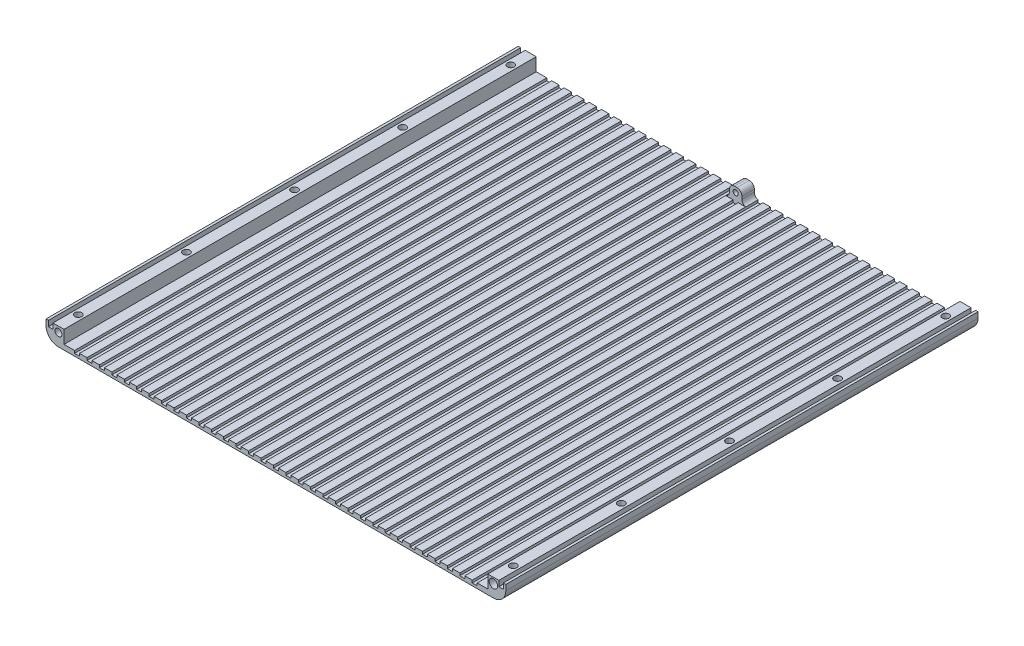
from build123d import *

# Parameters (mm, degrees)
BOSS_EXTRUDE1_DEPTH = 190
SKETCH2_R           = 1.4
CUT_EXTRUDE1_DEPTH  = 6
SKETCH3_W           = 2
SKETCH3_H           = 190
CUT_EXTRUDE2_DEPTH  = 1
LPATTERN1_COUNT     = 17
LPATTERN1_PITCH     = 5
LPATTERN1_COL_COUNT = 17
LPATTERN1_COL_PITCH = 5
SKETCH6_W           = 1.8
SKETCH6_H           = 190
CUT_EXTRUDE3_DEPTH  = 2.2
SKETCH7_R           = 1.4
SKETCH7_R_2         = 1.718448872
CUT_EXTRUDE4_DEPTH  = 4
CUT_EXTRUDE5_START  = -186
SKETCH7_2_R         = 1.4
SKETCH7_2_R_2       = 1.718448872
CUT_EXTRUDE5_DEPTH  = 4
SKETCH8_W           = 5
SKETCH8_H           = 5
BOSS_EXTRUDE2_DEPTH = 5
SKETCH9_W           = 2
SKETCH9_H           = 1
BOSS_EXTRUDE3_DEPTH = 5
FILLET1_R           = 2
SKETCH10_R          = 1.015088348
CUT_EXTRUDE6_DEPTH  = 212.734315197


with BuildPart() as part:
    # Sketch1 → Boss-Extrude1 (new body)
    with BuildSketch(Plane.XY):
        with BuildLine():
            Line((-93.360155793, 1.088281402), (-93.360155793, 3.338281402))
            Line((-93.360155793, 3.338281402), (-86.110155793, 3.338281402))
            Line((-86.110155793, 3.338281402), (-86.110155793, -1.911718598))
            Line((-86.110155793, -1.911718598), (84.389844207, -1.911718598))
            Line((84.389844207, -1.911718598), (84.389844207, 3.338281402))
            Line((84.389844207, 3.338281402), (91.639844207, 3.338281402))
            Line((91.639844207, 3.338281402), (91.639844207, 1.088281402))
            ThreePointArc((91.639844207, 1.088281402), (90.175378113, -2.447252504), (86.639844207, -3.911718598))
            Line((86.639844207, -3.911718598), (-88.360155793, -3.911718598))
            ThreePointArc((-88.360155793, -3.911718598), (-91.895689699, -2.447252504), (-93.360155793, 1.088281402))
        make_face()
    extrude(amount=BOSS_EXTRUDE1_DEPTH)

    # Sketch2 → Cut-Extrude1 (cut)
    with BuildSketch(Plane(origin=(0, 3.338281402, 0), x_dir=(1, 0, 0), z_dir=(0, 1, 0))):
        with Locations(Location((-88.360155793, -8, 0), (0, 0, 180))):
            Circle(SKETCH2_R)
        with Locations(Location((-88.360155793, -182, 0), (0, 0, 180))):
            Circle(SKETCH2_R)
        with Locations(Location((86.639844207, -8, 0), (0, 0, 180))):
            Circle(SKETCH2_R)
        with Locations(Location((86.639844207, -182, 0), (0, 0, 180))):
            Circle(SKETCH2_R)
        with Locations(Location((-88.360155793, -95, 0), (0, 0, 180))):
            Circle(SKETCH2_R)
        with Locations(Location((86.639844207, -95, 0), (0, 0, 180))):
            Circle(SKETCH2_R)
        with Locations(Location((-88.360155793, -51.5, 0), (0, 0, 180))):
            Circle(SKETCH2_R)
        with Locations(Location((-88.360155793, -138.5, 0), (0, 0, 180))):
            Circle(SKETCH2_R)
        with Locations((86.639844207, -51.5)):
            Circle(SKETCH2_R)
        with Locations((86.639844207, -138.5)):
            Circle(SKETCH2_R)
    extrude(amount=-CUT_EXTRUDE1_DEPTH, mode=Mode.SUBTRACT)

    # Sketch3 → Cut-Extrude2 (cut)
    with BuildSketch(Plane(origin=(0, -1.911718598, 0), x_dir=(1, 0, 0), z_dir=(0, 1, 0))):
        with Locations((-0.860155793, -95)):
            Rectangle(SKETCH3_W, SKETCH3_H)
    cut_extrude2 = extrude(amount=-CUT_EXTRUDE2_DEPTH, mode=Mode.SUBTRACT)

    # LPattern1: Cut-Extrude2 ×17
    with Locations(*[(i * LPATTERN1_PITCH, 0, 0) for i in range(1, LPATTERN1_COUNT)]):
        add(cut_extrude2, mode=Mode.SUBTRACT)

    # LPattern1 col: Cut-Extrude2 ×17
    with Locations(*[(-i * LPATTERN1_COL_PITCH, 0, 0) for i in range(1, LPATTERN1_COL_COUNT)]):
        add(cut_extrude2, mode=Mode.SUBTRACT)

    # Sketch6 → Cut-Extrude3 (cut)
    with BuildSketch(Plane(origin=(0, 3.338281402, 0), x_dir=(1, 0, 0), z_dir=(0, 1, 0))):
        with Locations((-91.460155793, -95)):
            Rectangle(SKETCH6_W, SKETCH6_H)
        with Locations((89.739844207, -95)):
            Rectangle(SKETCH6_W, SKETCH6_H)
    extrude(amount=-CUT_EXTRUDE3_DEPTH, mode=Mode.SUBTRACT)

    # Sketch7 → Cut-Extrude4 (cut)
    with BuildSketch(Plane.XY.offset(190)):
        with Locations((-88.360155793, 1.088281402)):
            Circle(SKETCH7_R)
        with Locations((86.639844207, 1.088281402)):
            Circle(SKETCH7_R_2)
    extrude(amount=-CUT_EXTRUDE4_DEPTH, mode=Mode.SUBTRACT)

    # Sketch7<2> → Cut-Extrude5 (cut)
    with BuildSketch(Plane.XY.offset(190).offset(CUT_EXTRUDE5_START)):
        with Locations((-88.360155793, 1.088281402)):
            Circle(SKETCH7_2_R)
        with Locations((86.639844207, 1.088281402)):
            Circle(SKETCH7_2_R_2)
    extrude(amount=-CUT_EXTRUDE5_DEPTH, mode=Mode.SUBTRACT)

    # Sketch8 → Boss-Extrude2 (add)
    with BuildSketch(Plane(origin=(0, -1.911718598, 0), x_dir=(1, 0, 0), z_dir=(0, 1, 0))):
        with Locations((-0.860155793, -2.5)):
            Rectangle(SKETCH8_W, SKETCH8_H)
    extrude(amount=BOSS_EXTRUDE2_DEPTH)

    # Sketch9 → Boss-Extrude3 (add)
    with BuildSketch(Plane(origin=(0, 0, 0), x_dir=(-1, 0, 0), z_dir=(0, 0, -1))):
        with Locations((0.860155793, -2.411718598)):
            Rectangle(SKETCH9_W, SKETCH9_H)
    extrude(amount=-BOSS_EXTRUDE3_DEPTH)

    # Fillet1
    # the kernel refuses this fillet: 2 mm, written as the material it adds along each edge
    with BuildSketch(Plane(origin=(-3.360155793, -1.911718598, 5), x_dir=(-1, 0, 0), z_dir=(0, 0, -1))) as fillet1_piece_1:
        with BuildLine():
            CenterArc((2, 1.936491673), FILLET1_R, 180, 75.522487814)
            Line((0, 1.936491673), (0, 0))
            Line((0, 0), (1.5, 0))
        make_face()
    extrude(amount=5)
    with BuildSketch(Plane(origin=(1.639844207, -1.911718598, 0), x_dir=(0, 1, 0), z_dir=(0, 0, 1))) as fillet1_piece_2:
        with BuildLine():
            CenterArc((1.936491673, -2), FILLET1_R, 90, 75.522487814)
            Line((0, -1.5), (0, 0))
            Line((0, 0), (1.936491673, 0))
        make_face()
    extrude(amount=5)
    # the kernel refuses this fillet: 2 mm, written as the material it takes off along each edge
    with BuildSketch(Plane(origin=(-3.360155793, 3.088281402, 10), x_dir=(1, 0, 0), z_dir=(0, 0, -1)), Plane(origin=(1.639844207, 3.088281402, -5), x_dir=(-1, 0, 0), z_dir=(0, 0, 1))) as fillet1_2_piece_1:
        with BuildLine():
            CenterArc((FILLET1_R, FILLET1_R), FILLET1_R, 180, 90)
            Line((0, FILLET1_R), (0, 0))
            Line((0, 0), (FILLET1_R, 0))
        make_face()
    extrude(amount=15, mode=Mode.SUBTRACT)

    # Sketch10 → Cut-Extrude6 (cut, through all)
    with BuildSketch(Plane(origin=(0, 0, 0), x_dir=(-1, 0, 0), z_dir=(0, 0, -1))):
        with Locations((0.860155793, 1.088281402)):
            Circle(SKETCH10_R)
    extrude(amount=-CUT_EXTRUDE6_DEPTH, mode=Mode.SUBTRACT)


solid = part.part
